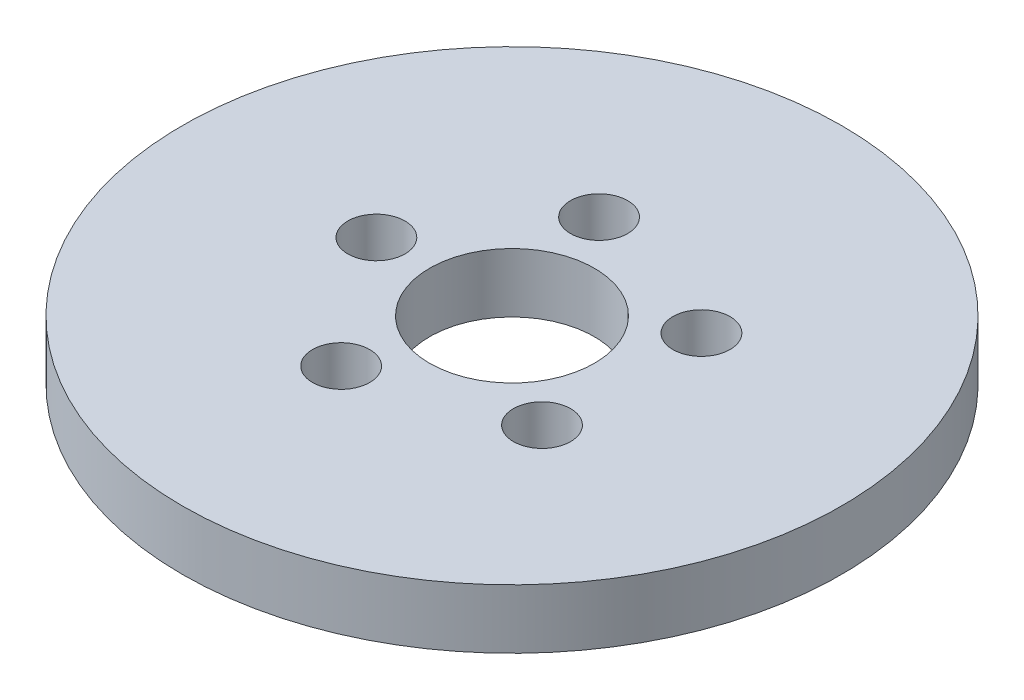
from build123d import *

# Parameters (mm, degrees)
SKETCH1_R           = 100
BOSS_EXTRUDE1_DEPTH = 18
SKETCH2_R           = 25
CUT_EXTRUDE1_DEPTH  = 143.562267098
SKETCH3_R           = 8.67448036
CUT_EXTRUDE2_DEPTH  = 17.413299708
CIRPATTERN1_COUNT   = 5


with BuildPart() as part:
    # Sketch1 → Boss-Extrude1 (new body)
    with BuildSketch(Plane(origin=(0, 0, 0), x_dir=(1, 0, 0), z_dir=(0, 1, 0))):
        Circle(SKETCH1_R)
    extrude(amount=BOSS_EXTRUDE1_DEPTH)

    # Sketch2 → Cut-Extrude1 (cut, through all)
    with BuildSketch(Plane(origin=(0, 0, 0), x_dir=(1, 0, 0), z_dir=(0, 1, 0))):
        Circle(SKETCH2_R)
    extrude(amount=CUT_EXTRUDE1_DEPTH, mode=Mode.SUBTRACT)

    # Sketch3 → Cut-Extrude2 (cut)
    with BuildSketch(Plane(origin=(0, 18, 0), x_dir=(1, 0, 0), z_dir=(0, 1, 0))):
        with Locations((-41.14917135, 0)):
            Circle(SKETCH3_R)
    cut_extrude2 = extrude(amount=-CUT_EXTRUDE2_DEPTH, mode=Mode.SUBTRACT)

    # CirPattern1: Cut-Extrude2 ×5 about axis
    cirpattern1_axis = Axis((0, 0, 0), (0, 1, 0))
    for i in range(1, CIRPATTERN1_COUNT):
        add(cut_extrude2.rotate(cirpattern1_axis, i * 360 / CIRPATTERN1_COUNT), mode=Mode.SUBTRACT)


solid = part.part
